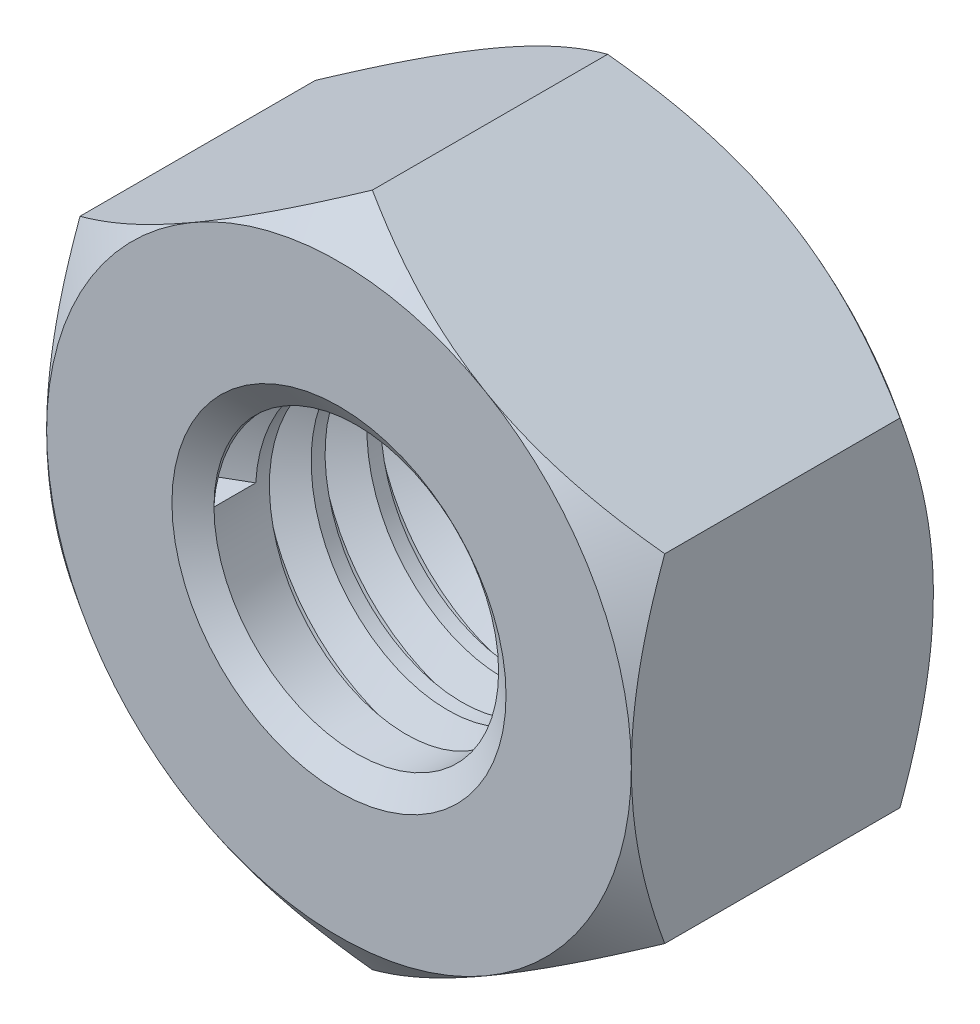
from build123d import *

# Parameters (mm, degrees)
BASENUTSKE_R  = 2.7051
BASENUT_DEPTH = 5.7404
THREAD1_PITCH = 1.058333333


with BuildPart() as part:
    # BaseNutSke → BaseNut (new body)
    with BuildSketch(Plane.XY):
        Polygon((5.55625, 3.207902433), (5.55625, -3.207902433), (0, -6.415804866), (-5.55625, -3.207902433), (-5.55625, 3.207902433), (0, 6.415804866), align=None)
        Circle(BASENUTSKE_R, mode=Mode.SUBTRACT)
    extrude(amount=-BASENUT_DEPTH)

    # Sketch3 → Double-Chamfer (revolve, cut)
    with BuildSketch(Plane(origin=(0, 0, 0), x_dir=(0, 0, -1), z_dir=(1, 0, 0))):
        Polygon((5.7404, 5.55625), (5.1054, 6.415804866), (5.1054, 19.115804866), (18.4404, 19.115804866), (18.4404, 5.55625), align=None)
        Polygon((0.635, 19.115804866), (-12.7, 19.115804866), (-12.7, 5.55625), (0, 5.55625), (0.635, 6.415804866), align=None)
    revolve(axis=Axis((0, 0, 0), (0, 0, -1)), mode=Mode.SUBTRACT)

    # Sketch5 → EndChamfer (revolve, cut)
    with BuildSketch(Plane(origin=(0, 0, 0), x_dir=(0, 0, -1), z_dir=(1, 0, 0)), mode=Mode.PRIVATE) as endchamfer_sk:
        Polygon((5.715, 3.175), (5.353069726, 2.65811), (5.7658, 2.65811), (5.7658, 3.175), align=None)
        Polygon((-0.0508, 3.175), (0, 3.175), (0.361930274, 2.65811), (-0.0508, 2.65811), align=None)
    revolve(endchamfer_sk.sketch.rotate(Axis((0, 0, -25.037505729), (0, 0, -1)), 90), axis=Axis((0, 0, -25.037505729), (0, 0, -1)), mode=Mode.SUBTRACT)

    # Thread1: the profile of Thread Profile1 profile screwed along a right-hand helix of 4.778216 turns, 8 arcs to a turn; built about Z, then put on its axis
    thread1_z = Axis((0, 0, 0), (0, 0, 1))
    thread1_corners = [(2.7048, 0, -0.000173205), (3.277939718, 0, 0.330729165), (3.277939718, 0, 0.463020832), (2.7048, 0, 0.793923202)]
    with BuildLine(mode=Mode.PRIVATE) as thread1_profile:
        Line(thread1_corners[0], thread1_corners[1])
        Line(thread1_corners[1], thread1_corners[2])
        Line(thread1_corners[2], thread1_corners[3])
        Line(thread1_corners[3], thread1_corners[0])
    thread1_cap = Face(thread1_profile.wire())
    thread1_turn_angles = [0, 22.5, 45, 67.5, 90, 112.5, 135, 157.5, 180, 202.5, 225, 247.5, 270, 292.5, 315, 337.5, 360]
    thread1_turn_weights = [1, 0.9238795325112867, 1, 0.9238795325112867, 1, 0.9238795325112867, 1, 0.9238795325112867, 1, 0.9238795325112867, 1, 0.9238795325112867, 1, 0.9238795325112867, 1, 0.9238795325112867, 1]
    thread1_turn_rails = [Edge.make_bspline([Vector(p[0], p[1], 0).rotate(thread1_z, thread1_turn_angles[k]) / thread1_turn_weights[k] + Vector(0, 0, p[2] + THREAD1_PITCH * thread1_turn_angles[k] / 360) for k in range(17)], [0, 0, 0, 1, 1, 2, 2, 3, 3, 4, 4, 5, 5, 6, 6, 7, 7, 8, 8, 8], 2, thread1_turn_weights) for p in thread1_corners]
    thread1_turn_sides = [Face.make_surface_from_curves(thread1_turn_rails[p[0]], thread1_turn_rails[p[1]]) for p in [(0, 1), (1, 2), (2, 3), (3, 0)]]
    thread1_last_angles = [1440, 1462.5, 1485, 1507.5, 1530, 1552.5, 1575, 1597.5, 1620, 1642.5, 1665, 1687.5, 1710, 1715.078827093, 1720.157654185]
    thread1_last_weights = [1, 0.9238795325112867, 1, 0.9238795325112867, 1, 0.9238795325112867, 1, 0.9238795325112867, 1, 0.9238795325112867, 1, 0.9238795325112867, 1, 0.9960738471286301, 1]
    thread1_last_rails = [Edge.make_bspline([Vector(p[0], p[1], 0).rotate(thread1_z, thread1_last_angles[k]) / thread1_last_weights[k] + Vector(0, 0, p[2] + THREAD1_PITCH * thread1_last_angles[k] / 360) for k in range(15)], [0, 0, 0, 1, 1, 2, 2, 3, 3, 4, 4, 5, 5, 6, 6, 7, 7, 7], 2, thread1_last_weights) for p in thread1_corners]
    thread1_last_sides = [Face.make_surface_from_curves(thread1_last_rails[p[0]], thread1_last_rails[p[1]]) for p in [(0, 1), (1, 2), (2, 3), (3, 0)]]
    thread1 = Plane(origin=(0, 0, -0.329027522), x_dir=(-1, 0, 0), z_dir=(0, 0, -1)) * Solid(Shell([*[p.moved(Location((0, 0, THREAD1_PITCH * i))) for i in range(4) for p in thread1_turn_sides], *thread1_last_sides, thread1_cap, thread1_cap.rotate(thread1_z, 1720.157654185).moved(Location((0, 0, THREAD1_PITCH * 1720.157654185 / 360)))]))
    add(thread1, mode=Mode.SUBTRACT)


solid = part.part
